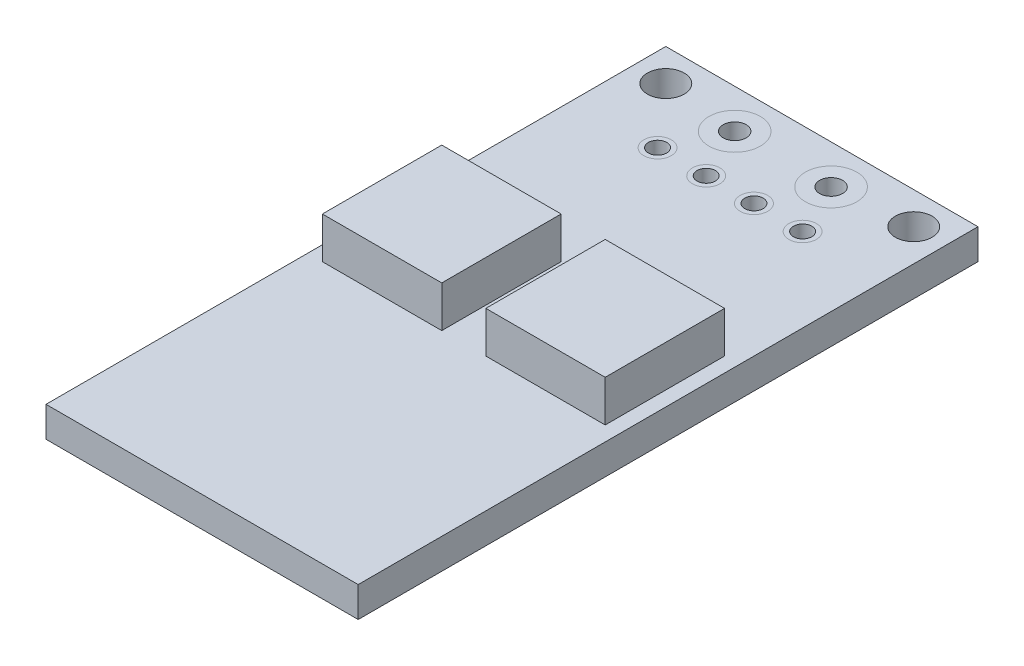
from build123d import *

# Parameters (mm, degrees)
PCB_SKETCH_W                     = 17
PCB_SKETCH_H                     = 33.75
PCB_EXTRUDE_DEPTH                = 1.65
THROUGH_HOLE_SKETCH_R            = 1.4
THROUGH_HOLE_SKETCH_R_2          = 0.625
THROUGH_HOLE_SKETCH_R_3          = 0.75
THROUGH_HOLE_SKETCH_R_4          = 0.5
THROUGH_HOLE_CUT_DEPTH           = 19.966763693
MOUNTING_HOLES_SKETCH_R          = 1
MOUNTING_HOLE_CUT_DEPTH          = 1.65
HOLES_MIRROR_OUTLINE_R           = 1.4
HOLES_MIRROR_OUTLINE_R_2         = 0.75
HOLES_MIRROR_OUTLINE_R_3         = 1
HOLES_MIRROR_DEPTH               = 1.65
THROUGH_HOLE_EXTRUDE_OUTLINE_R   = 0.75
THROUGH_HOLE_EXTRUDE_OUTLINE_R_2 = 0.5
THROUGH_HOLE_EXTRUDE_OUTLINE_R_3 = 1.4
THROUGH_HOLE_EXTRUDE_OUTLINE_R_4 = 0.625
THROUGH_HOLE_EXTRUDE_DEPTH       = 1.65
MOSFET_SKETCH_W                  = 6.5
MOSFET_SKETCH_H                  = 6.5
MOSFET_EXTRUDE_DEPTH             = 2.25


# Read off the part's stored shape, not the designer's step: Holes Mirror, Through Hole Extrude
with BuildPart() as part:
    # PCB Sketch → PCB Extrude (new body)
    with BuildSketch(Plane(origin=(0, 0, 0), x_dir=(1, 0, 0), z_dir=(0, 1, 0))):
        Rectangle(PCB_SKETCH_W, PCB_SKETCH_H)
    extrude(amount=PCB_EXTRUDE_DEPTH)

    # Through Hole Sketch → Through Hole Cut (cut, through all)
    # profile 1 of 4: a face of its own
    with BuildSketch(Plane(origin=(0, 1.65, 0), x_dir=(1, 0, 0), z_dir=(0, 1, 0))):
        with Locations(Location((-2.625, 14.75, 0), (0, 0, 270))):
            Circle(THROUGH_HOLE_SKETCH_R)
        with Locations((-2.625, 14.75)):
            Circle(THROUGH_HOLE_SKETCH_R_2, mode=Mode.SUBTRACT)
    # profile 2 of 4: a face of its own
    with BuildSketch(Plane(origin=(0, 1.65, 0), x_dir=(1, 0, 0), z_dir=(0, 1, 0))):
        with Locations((-2.625, 14.75)):
            Circle(THROUGH_HOLE_SKETCH_R_2)
    # profile 3 of 4: a face of its own
    with BuildSketch(Plane(origin=(0, 1.65, 0), x_dir=(1, 0, 0), z_dir=(0, 1, 0))):
        with Locations(Location((-1.3, 11.875, 0), (0, 0, 270))):
            Circle(THROUGH_HOLE_SKETCH_R_3)
        with Locations((-1.3, 11.875)):
            Circle(THROUGH_HOLE_SKETCH_R_4, mode=Mode.SUBTRACT)
    # profile 4 of 4: a face of its own
    with BuildSketch(Plane(origin=(0, 1.65, 0), x_dir=(1, 0, 0), z_dir=(0, 1, 0))):
        with Locations(Location((-3.95, 11.875, 0), (0, 0, 270))):
            Circle(THROUGH_HOLE_SKETCH_R_3)
    extrude(amount=-THROUGH_HOLE_CUT_DEPTH, mode=Mode.SUBTRACT)


with BuildPart() as through_hole_cut_kept_piece:
    # of the separate pieces the step leaves, the one the design keeps (through_hole_cut_pieces_kept)
    add(part.part.solids().sort_by_distance((-8.5, 0, 16.875))[0])

    # Mounting Holes Sketch → Mounting Hole Cut (cut)
    with BuildSketch(Plane(origin=(0, 1.65, 0), x_dir=(1, 0, 0), z_dir=(0, 1, 0))):
        with Locations(Location((-6.75, 15.125, 0), (0, 0, 270))):
            Circle(MOUNTING_HOLES_SKETCH_R)
    extrude(amount=-MOUNTING_HOLE_CUT_DEPTH, mode=Mode.SUBTRACT)

    # Holes Mirror outline → Holes Mirror (cut)
    with BuildSketch(Plane(origin=(0, 0, 0), x_dir=(1, 0, 0), z_dir=(0, 1, 0))):
        with Locations((2.625, 14.75)):
            Circle(HOLES_MIRROR_OUTLINE_R)
        with Locations((1.3, 11.875)):
            Circle(HOLES_MIRROR_OUTLINE_R_2)
        with Locations((3.95, 11.875)):
            Circle(HOLES_MIRROR_OUTLINE_R_2)
        with Locations((6.75, 15.125)):
            Circle(HOLES_MIRROR_OUTLINE_R_3)
    extrude(amount=HOLES_MIRROR_DEPTH, mode=Mode.SUBTRACT)


with BuildPart() as body_2:
    # Through Hole Extrude outline → Through Hole Extrude (new body)
    # profile 1 of 3: a face of its own
    with BuildSketch(Plane(origin=(0, 0, 0), x_dir=(1, 0, 0), z_dir=(0, 1, 0))):
        with Locations((-3.95, 11.875)):
            Circle(THROUGH_HOLE_EXTRUDE_OUTLINE_R)
        with Locations((-3.95, 11.875)):
            Circle(THROUGH_HOLE_EXTRUDE_OUTLINE_R_2, mode=Mode.SUBTRACT)
    # profile 2 of 3: a face of its own
    with BuildSketch(Plane(origin=(0, 0, 0), x_dir=(1, 0, 0), z_dir=(0, 1, 0))):
        with Locations((-1.3, 11.875)):
            Circle(THROUGH_HOLE_EXTRUDE_OUTLINE_R)
        with Locations((-1.3, 11.875)):
            Circle(THROUGH_HOLE_EXTRUDE_OUTLINE_R_2, mode=Mode.SUBTRACT)
    # profile 3 of 3: a face of its own
    with BuildSketch(Plane(origin=(0, 0, 0), x_dir=(1, 0, 0), z_dir=(0, 1, 0))):
        with Locations((-2.625, 14.75)):
            Circle(THROUGH_HOLE_EXTRUDE_OUTLINE_R_3)
        with Locations((-2.625, 14.75)):
            Circle(THROUGH_HOLE_EXTRUDE_OUTLINE_R_4, mode=Mode.SUBTRACT)
    extrude(amount=THROUGH_HOLE_EXTRUDE_DEPTH)


with BuildPart() as body_3:
    # Mosfet Sketch → Mosfet Extrude (new body)
    with BuildSketch(Plane(origin=(0, 1.65, 0), x_dir=(1, 0, 0), z_dir=(0, 1, 0))):
        with Locations((-4.45, 0.625)):
            Rectangle(MOSFET_SKETCH_W, MOSFET_SKETCH_H)
    extrude(amount=MOSFET_EXTRUDE_DEPTH)


with BuildPart() as body_4:
    # Bodies Mirror: mirrored copy
    add(body_2.part.mirror(Plane(origin=(0, 0, 0), x_dir=(0, 0, 1), z_dir=(1, 0, 0))))


with BuildPart() as body_5:
    # Bodies Mirror 2: mirrored copy
    add(body_3.part.mirror(Plane(origin=(0, 0, 0), x_dir=(0, 0, 1), z_dir=(1, 0, 0))))


solid = Compound([through_hole_cut_kept_piece.part, body_2.part, body_3.part, body_4.part, body_5.part])
